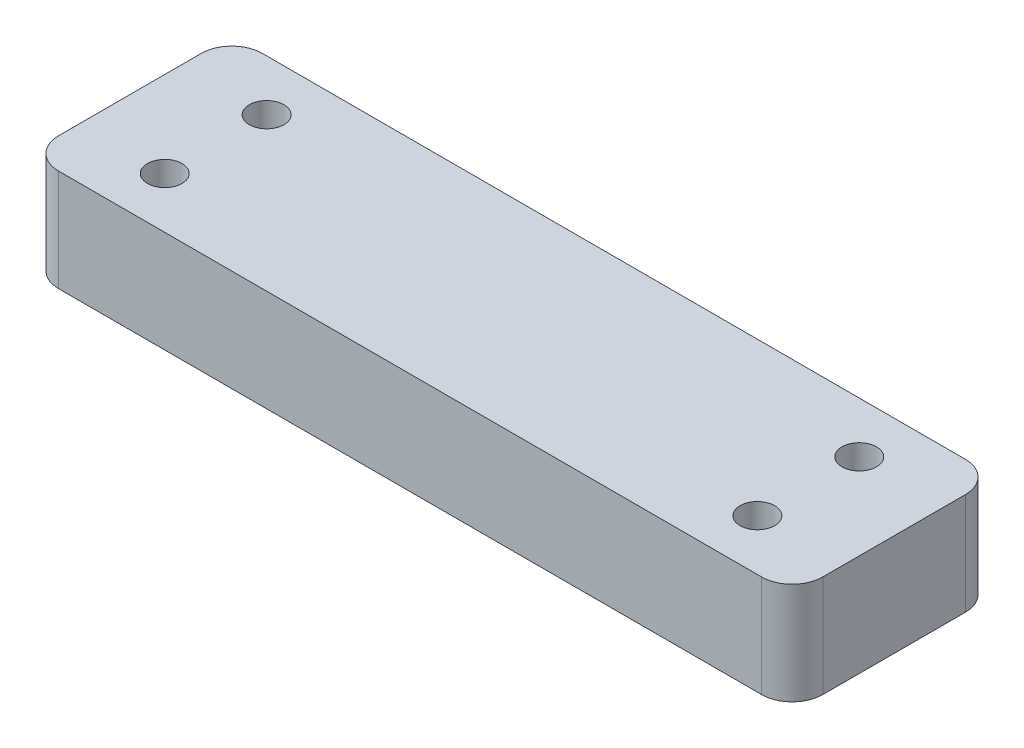
from build123d import *

# Parameters (mm, degrees)
SKETCH1_W            = 75
SKETCH1_H            = 20
BOSS_EXTRUDE1_DEPTH  = 10
FILLET1_R            = 3
M3_CLEARANCE_HOLE1_D = 3.4


with BuildPart() as part:
    # Sketch1 → Boss-Extrude1 (new body)
    with BuildSketch(Plane(origin=(0, 0, 0), x_dir=(1, 0, 0), z_dir=(0, 1, 0))):
        with Locations((37.5, 10)):
            Rectangle(SKETCH1_W, SKETCH1_H)
    extrude(amount=BOSS_EXTRUDE1_DEPTH)

    # Fillet1
    fillet1_edges = [part.edges().sort_by_distance(p)[0] for p in [
        (0, 5, -20),
        (0, 5, 0),
        (75, 5, -20),
        (75, 5, 0),
    ]]
    fillet(fillet1_edges, radius=FILLET1_R)

    # M3 Clearance Hole1 (through all)
    with Locations(Plane(origin=(50.035318197, 10, -35.416339767), x_dir=(1, 0, 0), z_dir=(0, 1, 0))):
        with Locations((16.545681803, -20.416339767), (16.545681803, -30.416339767), (-41.616318197, -30.416339767), (-41.616318197, -20.416339767)):
            Hole(M3_CLEARANCE_HOLE1_D / 2)


solid = part.part
